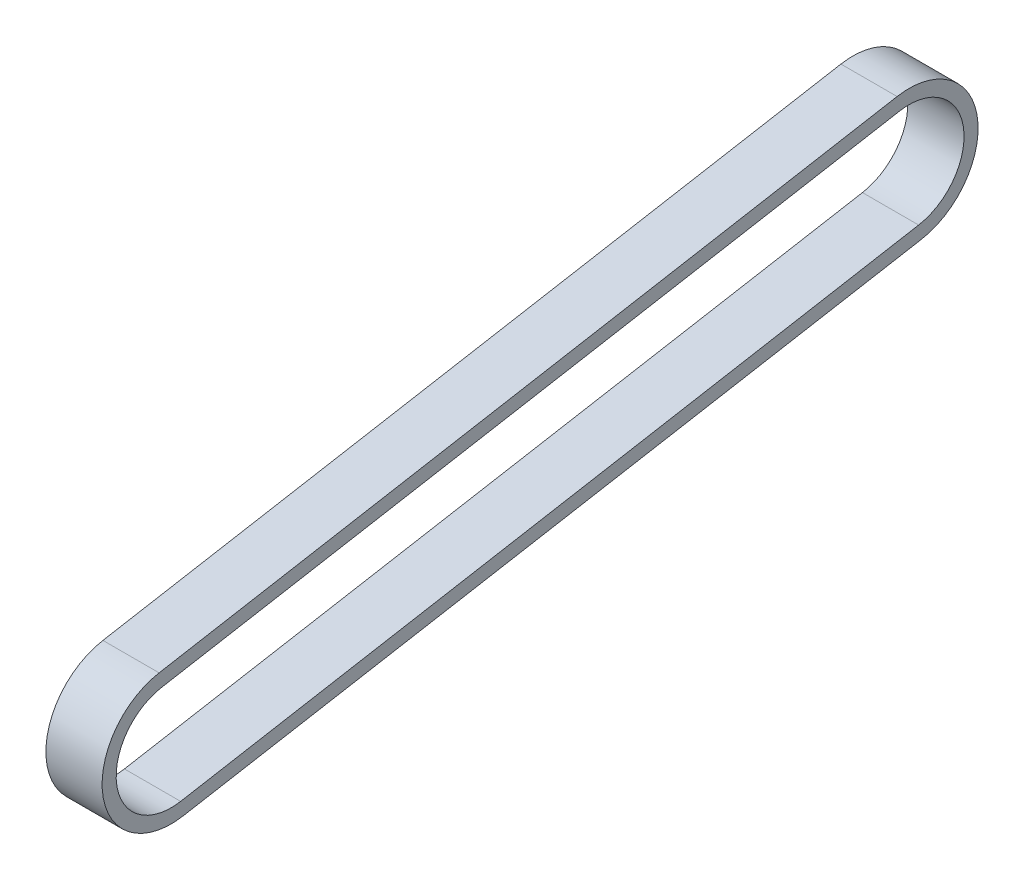
from build123d import *

# Parameters (mm, degrees)
BOSS_EXTRUDE1_DEPTH = 3


with BuildPart() as part:
    # Sketch2 → Boss-Extrude1 (new, symmetric)
    with BuildSketch(Plane.ZY.offset(34.45)):
        with BuildLine():
            Line((40.063712718, 63.362239695), (-38.720907523, 77.254093909))
            ThreePointArc((-38.720907523, 77.254093909), (-47.254093909, 71.279092477), (-41.279092477, 62.745906091))
            Line((-41.279092477, 62.745906091), (37.505527764, 48.854051878))
            ThreePointArc((37.505527764, 48.854051878), (46.03871415, 54.82905331), (40.063712718, 63.362239695))
        make_face()
        with BuildLine():
            ThreePointArc((-41.01862021, 64.223117721), (-45.776882279, 71.01862021), (-38.98137979, 75.776882279))
            Line((-38.98137979, 75.776882279), (39.803240451, 61.885028066))
            ThreePointArc((39.803240451, 61.885028066), (44.56150252, 55.089525576), (37.766000031, 50.331263507))
            Line((37.766000031, 50.331263507), (-41.01862021, 64.223117721))
        make_face(mode=Mode.SUBTRACT)
    extrude(amount=BOSS_EXTRUDE1_DEPTH, both=True)


solid = part.part
